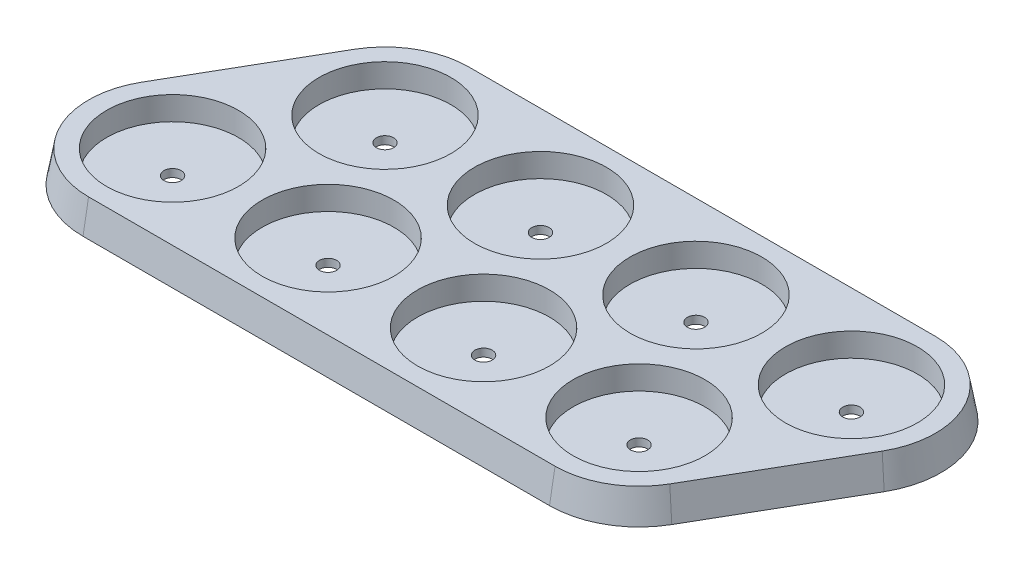
from build123d import *

# Parameters (mm, degrees)
BOSS_EXTRUDE1_DEPTH = 4
BOSS_EXTRUDE1_DRAFT = 10
CUT_EXTRUDE1_START  = 4
SKETCH1_3_R         = 1.1
CUT_EXTRUDE1_DEPTH  = 4
CUT_EXTRUDE2_START  = 4
SKETCH1_4_R         = 8.4
SKETCH1_4_R_2       = 1.1
CUT_EXTRUDE2_DEPTH  = 3


# Read off the part's stored shape, not the designer's step: Boss-Extrude1
with BuildPart() as part:
    # Boss-Extrude1 outline → Boss-Extrude1 (with draft: the straight prism first)
    with BuildSketch(Plane(origin=(0, 4, 0), x_dir=(1, 0, 0), z_dir=(0, 1, 0))):
        with BuildLine():
            ThreePointArc((-78.561875024, -11.799956956), (-78.561875024, -22.494649034), (-69.3, -27.841995072))
            Line((-69.3, -27.841995072), (-9.9, -27.841995072))
            ThreePointArc((-9.9, -27.841995072), (-4.552653961, -26.409178019), (-0.638124976, -22.494649034))
            Line((-0.638124976, -22.494649034), (9.261875024, -5.347346039))
            ThreePointArc((9.261875024, -5.347346039), (9.261875024, 5.347346039), (0, 10.694692077))
            Line((0, 10.694692077), (-59.4, 10.694692077))
            ThreePointArc((-59.4, 10.694692077), (-64.747346039, 9.261875024), (-68.661875024, 5.347346039))
            Line((-68.661875024, 5.347346039), (-78.561875024, -11.799956956))
        make_face()
    extrude(amount=-BOSS_EXTRUDE1_DEPTH)
    # Boss-Extrude1: the draft: its side faces are tilted about the plane it starts from
    boss_extrude1_sides = [part.faces().sort_by_distance(p)[0] for p in [
        (-73.611875024, 2, 3.226305459),
        (-78.561875024, 2, 22.494649033),
        (-39.6, 2, 27.841995072),
        (-4.552653962, 2, 26.409178019),
        (4.311875024, 2, 13.920997536),
        (9.261875024, 2, -5.347346038),
        (-29.7, 2, -10.694692077),
        (-64.747346038, 2, -9.261875024),
    ]]
    draft(boss_extrude1_sides, Plane(origin=(0, 4, 0), x_dir=(1, 0, 0), z_dir=(0, 1, 0)), BOSS_EXTRUDE1_DRAFT)

    # Sketch1<3> → Cut-Extrude1 (cut)
    with BuildSketch(Plane(origin=(0, 0, 0), x_dir=(1, 0, 0), z_dir=(0, 1, 0)).offset(CUT_EXTRUDE1_START)):
        with Locations(Location((-9.9, -17.147302995, 0), (0, 0, 270))):
            Circle(SKETCH1_3_R)
        with Locations(Location((0, 0, 0), (0, 0, 270))):
            Circle(SKETCH1_3_R)
        with Locations(Location((-29.7, -17.147302995, 0), (0, 0, 270))):
            Circle(SKETCH1_3_R)
        with Locations(Location((-39.6, 0, 0), (0, 0, 270))):
            Circle(SKETCH1_3_R)
        with Locations(Location((-49.5, -17.147302995, 0), (0, 0, 270))):
            Circle(SKETCH1_3_R)
        with Locations(Location((-59.4, 0, 0), (0, 0, 270))):
            Circle(SKETCH1_3_R)
        with Locations(Location((-69.3, -17.147302995, 0), (0, 0, 270))):
            Circle(SKETCH1_3_R)
        with Locations(Location((-19.8, 0, 0), (0, 0, 270))):
            Circle(SKETCH1_3_R)
    extrude(amount=-CUT_EXTRUDE1_DEPTH, mode=Mode.SUBTRACT)

    # Sketch1<4> → Cut-Extrude2 (cut)
    # profile 1 of 8: a face of its own
    with BuildSketch(Plane(origin=(0, 0, 0), x_dir=(1, 0, 0), z_dir=(0, 1, 0)).offset(CUT_EXTRUDE2_START)):
        with Locations(Location((-19.8, 0, 0), (0, 0, 270))):
            Circle(SKETCH1_4_R)
        with Locations(Location((-19.8, 0, 0), (0, 0, 270))):
            Circle(SKETCH1_4_R_2, mode=Mode.SUBTRACT)
    # profile 2 of 8: a face of its own
    with BuildSketch(Plane(origin=(0, 0, 0), x_dir=(1, 0, 0), z_dir=(0, 1, 0)).offset(CUT_EXTRUDE2_START)):
        with Locations(Location((-9.9, -17.147302995, 0), (0, 0, 270))):
            Circle(SKETCH1_4_R)
        with Locations(Location((-9.9, -17.147302995, 0), (0, 0, 270))):
            Circle(SKETCH1_4_R_2, mode=Mode.SUBTRACT)
    # profile 3 of 8: a face of its own
    with BuildSketch(Plane(origin=(0, 0, 0), x_dir=(1, 0, 0), z_dir=(0, 1, 0)).offset(CUT_EXTRUDE2_START)):
        with Locations(Location((0, 0, 0), (0, 0, 270))):
            Circle(SKETCH1_4_R)
        with Locations(Location((0, 0, 0), (0, 0, 270))):
            Circle(SKETCH1_4_R_2, mode=Mode.SUBTRACT)
    # profile 4 of 8: a face of its own
    with BuildSketch(Plane(origin=(0, 0, 0), x_dir=(1, 0, 0), z_dir=(0, 1, 0)).offset(CUT_EXTRUDE2_START)):
        with Locations(Location((-29.7, -17.147302995, 0), (0, 0, 270))):
            Circle(SKETCH1_4_R)
        with Locations(Location((-29.7, -17.147302995, 0), (0, 0, 270))):
            Circle(SKETCH1_4_R_2, mode=Mode.SUBTRACT)
    # profile 5 of 8: a face of its own
    with BuildSketch(Plane(origin=(0, 0, 0), x_dir=(1, 0, 0), z_dir=(0, 1, 0)).offset(CUT_EXTRUDE2_START)):
        with Locations(Location((-39.6, 0, 0), (0, 0, 270))):
            Circle(SKETCH1_4_R)
        with Locations(Location((-39.6, 0, 0), (0, 0, 270))):
            Circle(SKETCH1_4_R_2, mode=Mode.SUBTRACT)
    # profile 6 of 8: a face of its own
    with BuildSketch(Plane(origin=(0, 0, 0), x_dir=(1, 0, 0), z_dir=(0, 1, 0)).offset(CUT_EXTRUDE2_START)):
        with Locations(Location((-49.5, -17.147302995, 0), (0, 0, 270))):
            Circle(SKETCH1_4_R)
        with Locations(Location((-49.5, -17.147302995, 0), (0, 0, 270))):
            Circle(SKETCH1_4_R_2, mode=Mode.SUBTRACT)
    # profile 7 of 8: a face of its own
    with BuildSketch(Plane(origin=(0, 0, 0), x_dir=(1, 0, 0), z_dir=(0, 1, 0)).offset(CUT_EXTRUDE2_START)):
        with Locations(Location((-59.4, 0, 0), (0, 0, 270))):
            Circle(SKETCH1_4_R)
        with Locations(Location((-59.4, 0, 0), (0, 0, 270))):
            Circle(SKETCH1_4_R_2, mode=Mode.SUBTRACT)
    # profile 8 of 8: a face of its own
    with BuildSketch(Plane(origin=(0, 0, 0), x_dir=(1, 0, 0), z_dir=(0, 1, 0)).offset(CUT_EXTRUDE2_START)):
        with Locations(Location((-69.3, -17.147302995, 0), (0, 0, 270))):
            Circle(SKETCH1_4_R)
        with Locations(Location((-69.3, -17.147302995, 0), (0, 0, 270))):
            Circle(SKETCH1_4_R_2, mode=Mode.SUBTRACT)
    extrude(amount=-CUT_EXTRUDE2_DEPTH, mode=Mode.SUBTRACT)


solid = part.part
